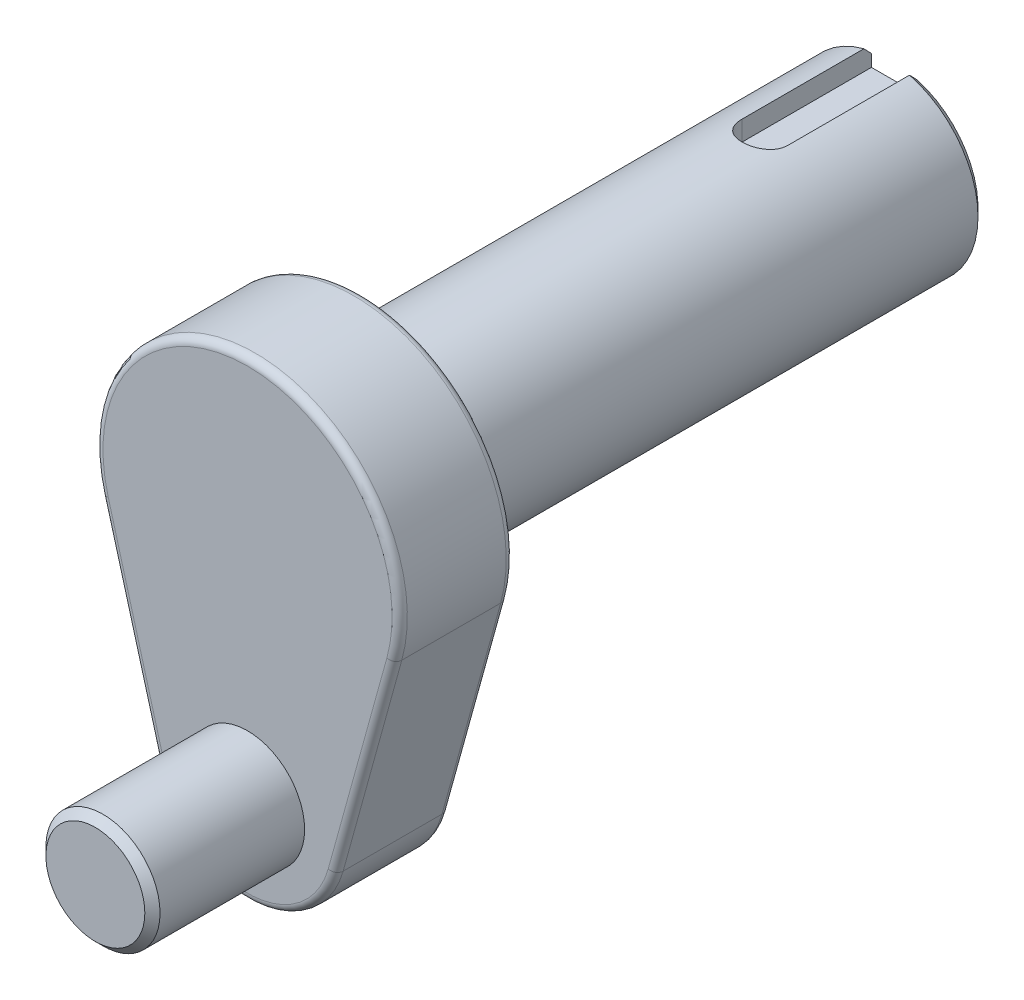
from build123d import *

# Parameters (mm, degrees)
SKETCH_1_R          = 6
EXTRUDE_1_DEPTH     = 35
EXTRUDE_2_DEPTH     = 7.5
SKETCH_3_R          = 3.75
EXTRUDE_3_DEPTH     = 10
CHAMFER_1_SIZE      = 0.5
CHAMFER_2_SIZE      = 0.5
SKETCH_5_W          = 3
SKETCH_5_H          = 3
CUT_EXTRUDE_1_DEPTH = 10
FILLET_1_R          = 1.5
FILLET_2_R          = 0.5


with BuildPart() as part:
    # 草图1 → 凸台-拉伸1 (new body)
    with BuildSketch(Plane.XY):
        Circle(SKETCH_1_R)
    extrude(amount=-EXTRUDE_1_DEPTH)

    # 草图2 → 凸台-拉伸2 (add)
    with BuildSketch(Plane.XY):
        with BuildLine():
            Line((9.637888197, -2.666666667), (5.782732918, -16.6))
            ThreePointArc((5.782732918, -16.6), (0, -21), (-5.782732918, -16.6))
            Line((-5.782732918, -16.6), (-9.637888197, -2.666666667))
            ThreePointArc((-9.637888197, -2.666666667), (0, 10), (9.637888197, -2.666666667))
        make_face()
    extrude(amount=EXTRUDE_2_DEPTH)

    # 草图3 → 凸台-拉伸3 (add)
    with BuildSketch(Plane.XY.offset(7.5)):
        with Locations((0, -15)):
            Circle(SKETCH_3_R)
    extrude(amount=EXTRUDE_3_DEPTH)

    # 倒角1
    chamfer_1_edges = [part.edges().sort_by_distance(p)[0] for p in [
        (-3.75, -15, 17.5),
    ]]
    chamfer(chamfer_1_edges, length=CHAMFER_1_SIZE)

    # 倒角2
    chamfer_2_edges = [part.edges().sort_by_distance(p)[0] for p in [
        (-6, 0, -35),
    ]]
    chamfer(chamfer_2_edges, length=CHAMFER_2_SIZE)

    # 草图5 → 切除-拉伸1 (cut)
    with BuildSketch(Plane(origin=(0, 0, -35), x_dir=(-1, 0, 0), z_dir=(0, 0, -1))):
        with Locations((0, 6)):
            Rectangle(SKETCH_5_W, SKETCH_5_H)
    extrude(amount=-CUT_EXTRUDE_1_DEPTH, mode=Mode.SUBTRACT)

    # 圆角1
    fillet_1_edges = [part.edges().sort_by_distance(p)[0] for p in [
        (-1.5, 5.15473751, -25),
        (1.5, 5.15473751, -25),
    ]]
    fillet(fillet_1_edges, radius=FILLET_1_R - 0.0001)  # a hair under: the kernel refuses the full size

    # 圆角2
    fillet_2_edges = [part.edges().sort_by_distance(p)[0] for p in [
        (0, -21, 0),
        (7.710310557, -9.633333333, 0),
        (0, 10, 0),
        (-7.710310557, -9.633333333, 0),
        (0, -21, 7.5),
        (7.710310557, -9.633333333, 7.5),
        (0, 10, 7.5),
        (-7.710310557, -9.633333333, 7.5),
    ]]
    fillet(fillet_2_edges, radius=FILLET_2_R)


solid = part.part
